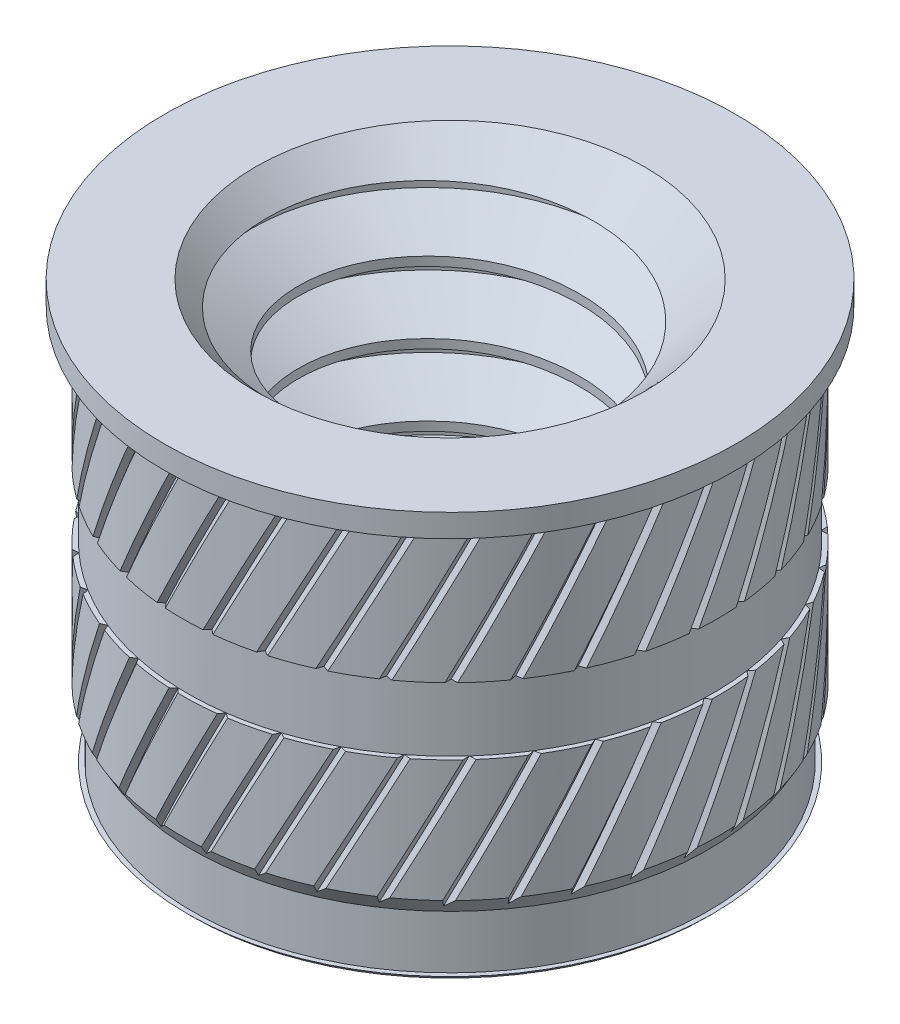
from build123d import *

# Parameters (mm, degrees)
SKETCH1_R         = 2.8702
EXTRUDE1_DEPTH    = 4.699
SKETCH1_4_R       = 2.9718
EXTRUDE2_DEPTH    = 3.880762
SKETCH1_3_R       = 3.175
EXTRUDE3_DEPTH    = 0.254
SKETCH2_R         = 2.9718
EXTRUDE4_DEPTH    = 0.175976
EXTRUDE4_TAPER    = 30
SKETCH8_R         = 1.567244252
EXTRUDE6_DEPTH    = 4.699
CHAMFER1_SIZE     = 0.5953125
CUT_SWEEP1_PITCH  = 0.79375
CUT_SWEEP2_PITCH  = 37.1475
CIRPATTERN1_COUNT = 36
SKETCH11_W        = 0.254
SKETCH11_H        = 0.74295


with BuildPart() as part:
    # Sketch1 → Extrude1 (new body)
    with BuildSketch(Plane(origin=(0, 0, 0), x_dir=(1, 0, 0), z_dir=(0, 1, 0))):
        with Locations(Location((0, 0, 0), (0, 0, 270))):
            Circle(SKETCH1_R)
    extrude(amount=-EXTRUDE1_DEPTH)

    # Sketch1<4> → Extrude2 (add)
    with BuildSketch(Plane(origin=(0, 0, 0), x_dir=(1, 0, 0), z_dir=(0, 1, 0))):
        with Locations(Location((0, 0, 0), (0, 0, 270))):
            Circle(SKETCH1_4_R)
    extrude(amount=-EXTRUDE2_DEPTH)

    # Sketch1<3> → Extrude3 (add)
    with BuildSketch(Plane(origin=(0, 0, 0), x_dir=(1, 0, 0), z_dir=(0, 1, 0))):
        with Locations(Location((0, 0, 0), (0, 0, 270))):
            Circle(SKETCH1_3_R)
    extrude(amount=-EXTRUDE3_DEPTH)

    # Sketch2 → Extrude4 (add)
    with BuildSketch(Plane.XZ.offset(3.880761819)):
        with Locations(Location((0, 0, 0), (0, 0, 90))):
            Circle(SKETCH2_R)
    extrude(amount=EXTRUDE4_DEPTH, taper=EXTRUDE4_TAPER)

    # Extrude5: read off the stored shape, not the designer's step
    # Extrude5 outline → Extrude5 (revolve)
    with BuildSketch(Plane.XY):
        Polygon((2.8702, -4.6482), (2.8702, -4.699), (2.921, -4.6482), align=None)
    revolve(axis=Axis((0, 0, 0), (0, 1, 0)))

    # Sketch8 → Extrude6 (cut)
    with BuildSketch(Plane(origin=(0, 0, 0), x_dir=(1, 0, 0), z_dir=(0, 1, 0))):
        with Locations(Location((0, 0, 0), (0, 0, 270))):
            Circle(SKETCH8_R)
    extrude(amount=-EXTRUDE6_DEPTH, mode=Mode.SUBTRACT)

    # Chamfer1
    chamfer1_edges = [part.edges().sort_by_distance(p)[0] for p in [
        (0, -4.699, -1.567244252),
        (0, 0, -1.567244252),
    ]]
    chamfer(chamfer1_edges, length=CHAMFER1_SIZE)

    # Cut-Sweep1: arcs per turn and ends read off the stored shape
    # Cut-Sweep1: the profile of Sketch7 screwed along a right-hand helix through 16.973096 turns, 8 arcs to a turn; built about Z, then put on its axis
    cut_sweep1_z = Axis((0, 0, 0), (0, 0, 1))
    cut_sweep1_corners = [(2.0828, 0, -0.396875), (2.0828, 0, -0.29765625), (1.524281273, 0, 0.024804687), (1.524281273, 0, -0.719335937)]
    with BuildLine(mode=Mode.PRIVATE) as cut_sweep1_profile:
        Line(cut_sweep1_corners[0], cut_sweep1_corners[1])
        Line(cut_sweep1_corners[1], cut_sweep1_corners[2])
        Line(cut_sweep1_corners[2], cut_sweep1_corners[3])
        Line(cut_sweep1_corners[3], cut_sweep1_corners[0])
    cut_sweep1_cap = Face(cut_sweep1_profile.wire())
    cut_sweep1_turn_angles = [0, 22.5, 45, 67.5, 90, 112.5, 135, 157.5, 180, 202.5, 225, 247.5, 270, 292.5, 315, 337.5, 360]
    cut_sweep1_turn_weights = [1, 0.9238795325112867, 1, 0.9238795325112867, 1, 0.9238795325112867, 1, 0.9238795325112867, 1, 0.9238795325112867, 1, 0.9238795325112867, 1, 0.9238795325112867, 1, 0.9238795325112867, 1]
    cut_sweep1_turn_rails = [Edge.make_bspline([Vector(p[0], p[1], 0).rotate(cut_sweep1_z, cut_sweep1_turn_angles[k]) / cut_sweep1_turn_weights[k] + Vector(0, 0, p[2] + CUT_SWEEP1_PITCH * cut_sweep1_turn_angles[k] / 360) for k in range(17)], [0, 0, 0, 1, 1, 2, 2, 3, 3, 4, 4, 5, 5, 6, 6, 7, 7, 8, 8, 8], 2, cut_sweep1_turn_weights) for p in cut_sweep1_corners]
    cut_sweep1_turn_sides = [Face.make_surface_from_curves(cut_sweep1_turn_rails[p[0]], cut_sweep1_turn_rails[p[1]]) for p in [(0, 1), (1, 2), (2, 3), (3, 0)]]
    cut_sweep1_last_angles = [5760, 5782.5, 5805, 5827.5, 5850, 5872.5, 5895, 5917.5, 5940, 5962.5, 5985, 6007.5, 6030, 6052.5, 6075, 6092.657368468, 6110.314736935]
    cut_sweep1_last_weights = [1, 0.9238795325112867, 1, 0.9238795325112867, 1, 0.9238795325112867, 1, 0.9238795325112867, 1, 0.9238795325112867, 1, 0.9238795325112867, 1, 0.9238795325112867, 1, 0.9528874365463385, 1]
    cut_sweep1_last_rails = [Edge.make_bspline([Vector(p[0], p[1], 0).rotate(cut_sweep1_z, cut_sweep1_last_angles[k]) / cut_sweep1_last_weights[k] + Vector(0, 0, p[2] + CUT_SWEEP1_PITCH * cut_sweep1_last_angles[k] / 360) for k in range(17)], [0, 0, 0, 1, 1, 2, 2, 3, 3, 4, 4, 5, 5, 6, 6, 7, 7, 8, 8, 8], 2, cut_sweep1_last_weights) for p in cut_sweep1_corners]
    cut_sweep1_last_sides = [Face.make_surface_from_curves(cut_sweep1_last_rails[p[0]], cut_sweep1_last_rails[p[1]]) for p in [(0, 1), (1, 2), (2, 3), (3, 0)]]
    cut_sweep1 = Plane(origin=(0, 0, 0), x_dir=(-1, 0, 0), z_dir=(0, -1, 0)) * Solid(Shell([*[p.moved(Location((0, 0, CUT_SWEEP1_PITCH * i))) for i in range(16) for p in cut_sweep1_turn_sides], *cut_sweep1_last_sides, cut_sweep1_cap, cut_sweep1_cap.rotate(cut_sweep1_z, 6110.314736935).moved(Location((0, 0, CUT_SWEEP1_PITCH * 6110.314736935 / 360)))]))
    add(cut_sweep1, mode=Mode.SUBTRACT)

    # Cut-Sweep2: arcs per turn and ends read off the stored shape
    # Cut-Sweep2: the profile of Sketch10 screwed along a right-hand helix through 0.166667 turns, 24 arcs to a turn; built about Z, then put on its axis
    cut_sweep2_z = Axis((0, 0, 0), (0, 0, 1))
    cut_sweep2_corners = [(2.921, 0, 0), (2.9718, 0.0508, 0), (2.9718, -0.0508, 0)]
    with BuildLine(mode=Mode.PRIVATE) as cut_sweep2_profile:
        Line(cut_sweep2_corners[0], cut_sweep2_corners[1])
        Line(cut_sweep2_corners[1], cut_sweep2_corners[2])
        Line(cut_sweep2_corners[2], cut_sweep2_corners[0])
    cut_sweep2_cap = Face(cut_sweep2_profile.wire())
    cut_sweep2_turn_angles = [0, 7.5, 15, 22.5, 30, 37.5, 45, 52.5, 60]
    cut_sweep2_turn_weights = [1, 0.9914448613738104, 1, 0.9914448613738104, 1, 0.9914448613738104, 1, 0.9914448613738104, 1]
    cut_sweep2_turn_rails = [Edge.make_bspline([Vector(p[0], p[1], 0).rotate(cut_sweep2_z, cut_sweep2_turn_angles[k]) / cut_sweep2_turn_weights[k] + Vector(0, 0, p[2] + CUT_SWEEP2_PITCH * cut_sweep2_turn_angles[k] / 360) for k in range(9)], [0, 0, 0, 1, 1, 2, 2, 3, 3, 4, 4, 4], 2, cut_sweep2_turn_weights) for p in cut_sweep2_corners]
    cut_sweep2_turn_sides = [Face.make_surface_from_curves(cut_sweep2_turn_rails[p[0]], cut_sweep2_turn_rails[p[1]]) for p in [(0, 1), (1, 2), (2, 0)]]
    cut_sweep2 = Plane(origin=(0, -0.254, 0), x_dir=(0, 0, 1), z_dir=(0, -1, 0)) * Solid(Shell([*cut_sweep2_turn_sides, cut_sweep2_cap, cut_sweep2_cap.rotate(cut_sweep2_z, 60).moved(Location((0, 0, CUT_SWEEP2_PITCH * 60 / 360)))]))
    add(cut_sweep2, mode=Mode.SUBTRACT)

    # CirPattern1: Cut-Sweep2 ×36 about axis
    cirpattern1_axis = Axis((0, -3.880761819, 0), (0, 1, 0))
    for i in range(1, CIRPATTERN1_COUNT):
        add(cut_sweep2.rotate(cirpattern1_axis, i * 360 / CIRPATTERN1_COUNT), mode=Mode.SUBTRACT)

    # Sketch11 → Cut-Revolve1 (revolve, cut)
    with BuildSketch(Plane.XY, mode=Mode.PRIVATE) as cut_revolve1_sk:
        with Locations((-3.048, -2.155369091)):
            Rectangle(SKETCH11_W, SKETCH11_H)
    revolve(cut_revolve1_sk.sketch.rotate(Axis((0, 0, 0), (0, -1, 0)), 69.963171048), axis=Axis((0, 0, 0), (0, -1, 0)), mode=Mode.SUBTRACT)


solid = part.part
